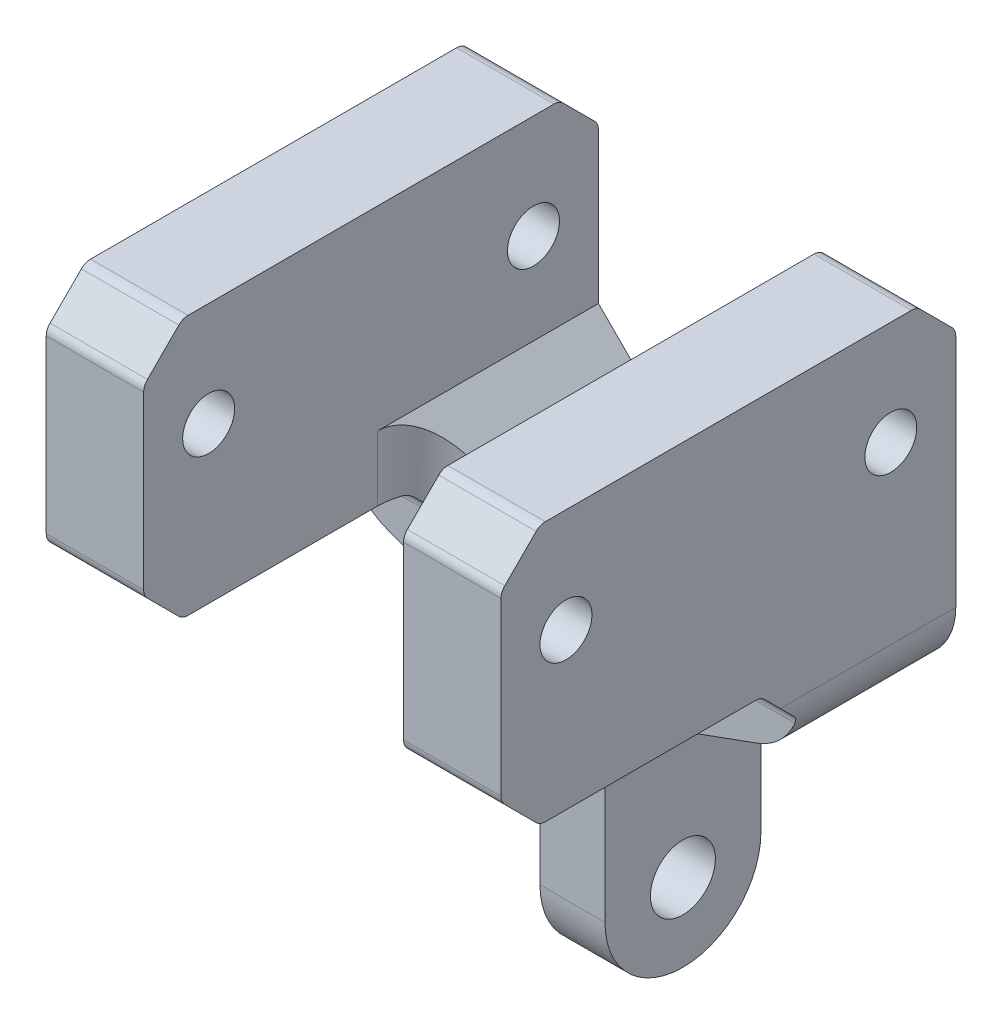
from build123d import *

# Parameters (mm, degrees)
BOSS_EXTRUDE1_DEPTH = 17.5
SKETCH2_W           = 20
SKETCH2_H           = 20
CUT_EXTRUDE1_DEPTH  = 64.492125496
SKETCH3_R           = 2
CUT_EXTRUDE2_DEPTH  = 71.356236397
CHAMFER1_SIZE       = 3
CHAMFER2_SIZE       = 5
FILLET1_RADIUS      = 6
FILLET1_LENGTH      = 5
SKETCH4_R           = 2.5
CUT_EXTRUDE3_DEPTH  = 35
FILLET2_R           = 5
FILLET3_R           = 1


with BuildPart() as part:
    # Sketch1 → Boss-Extrude1 (new, symmetric)
    with BuildSketch(Plane(origin=(0, 0, 0), x_dir=(0, 0, -1), z_dir=(1, 0, 0))):
        Polygon((0, 0), (-35, 0), (-35, -20), (-12, -20), (-12, -50), (0, -50), align=None)
    extrude(amount=BOSS_EXTRUDE1_DEPTH, both=True)

    # Sketch2 → Cut-Extrude1 (cut, through all)
    with BuildSketch(Plane(origin=(0, 0, 0), x_dir=(-1, 0, 0), z_dir=(0, 0, -1))):
        Polygon((17.5, -25), (2.5, -30.459553514), (2.5, -50), (17.5, -50), align=None)
        Polygon((-17.5, -50), (-17.5, -25), (-2.5, -30.459553514), (-2.5, -50), align=None)
        with Locations((0, -10)):
            Rectangle(SKETCH2_W, SKETCH2_H)
    extrude(amount=-CUT_EXTRUDE1_DEPTH, mode=Mode.SUBTRACT)

    # Sketch3 → Cut-Extrude2 (cut, through all)
    with BuildSketch(Plane.ZY.offset(17.5)):
        with Locations((5, -8)):
            Circle(SKETCH3_R)
        with Locations((30, -8)):
            Circle(SKETCH3_R)
    extrude(amount=-CUT_EXTRUDE2_DEPTH, mode=Mode.SUBTRACT)

    # Chamfer1
    chamfer1_edges = [part.edges().sort_by_distance(p)[0] for p in [
        (13.75, -20, 12),
        (13.75, -20, 35),
        (13.75, 0, 35),
        (13.75, 0, 0),
        (-13.75, -20, 12),
        (-13.75, -20, 35),
        (-13.75, 0, 35),
        (-13.75, 0, 0),
    ]]
    chamfer(chamfer1_edges, length=CHAMFER1_SIZE)

    # Chamfer2
    chamfer2_edges = [part.edges().sort_by_distance(p)[0] for p in [
        (-10, -20, 6),
        (10, -20, 6),
    ]]
    chamfer(chamfer2_edges, length=CHAMFER2_SIZE)

    # Fillet1: full round fillet: the end face becomes a half cylinder, R = half its width
    fillet1_face = Plane((0, -50, 6), x_dir=(1, 0, 0), z_dir=(0, -1, 0))  # on the end face: x along it, z out of the body
    fillet1_slab = fillet1_face.offset(-FILLET1_RADIUS / 2) * Box(FILLET1_LENGTH, 2 * FILLET1_RADIUS, FILLET1_RADIUS, mode=Mode.PRIVATE)  # the body's end, R deep
    fillet1_round = Plane((0, -44, 6), x_dir=(0, -1, 0), z_dir=(1, 0, 0)) * Cylinder(FILLET1_RADIUS, FILLET1_LENGTH, mode=Mode.PRIVATE)  # its axis R under the face
    add(fillet1_slab - fillet1_round, mode=Mode.SUBTRACT)

    # Sketch4 → Cut-Extrude3 (cut)
    with BuildSketch(Plane(origin=(2.5, 0, 0), x_dir=(0, 0, -1), z_dir=(1, 0, 0))):
        with Locations(Location((-6, -44, 0), (0, 0, 90))):
            Circle(SKETCH4_R)
    extrude(amount=-CUT_EXTRUDE3_DEPTH, mode=Mode.SUBTRACT)

    # Fillet2
    # the kernel refuses this fillet: 5 mm, written as the material it adds along each edge
    with BuildSketch(Plane(origin=(10, -35.5, 12), x_dir=(-1, 0, 0), z_dir=(0, 1, 0))) as fillet2_piece_1_section:
        with BuildLine():
            CenterArc((FILLET2_R, FILLET2_R), FILLET2_R, 180, 90)
            Line((0, FILLET2_R), (0, 0))
            Line((0, 0), (FILLET2_R, 0))
        make_face()
    fillet2_piece_1 = extrude(amount=33, mode=Mode.PRIVATE)
    fillet2_piece_1 = split(fillet2_piece_1, bisect_by=Plane(origin=(9.996559124, -19.16276417, 15.83723583), z_dir=(0, -0.7071067811865476, 0.7071067811865476)), keep=Keep.TOP, mode=Mode.PRIVATE)
    fillet2_piece_1 = split(fillet2_piece_1, bisect_by=Plane(origin=(9.996559124, -20, 16.11631444), z_dir=(0, 1, 0)), keep=Keep.TOP, mode=Mode.PRIVATE)
    add(fillet2_piece_1)
    with BuildSketch(Plane(origin=(10, -35.5, 12), x_dir=(-1, 0, 0), z_dir=(0, 1, 0))) as fillet2_piece_2_section:
        with BuildLine():
            CenterArc((FILLET2_R, FILLET2_R), FILLET2_R, 180, 90)
            Line((0, FILLET2_R), (0, 0))
            Line((0, 0), (FILLET2_R, 0))
        make_face()
    fillet2_piece_2 = extrude(amount=33, mode=Mode.PRIVATE)
    fillet2_piece_2 = split(fillet2_piece_2, bisect_by=Plane(origin=(8.541566655, -21.793394373, 13.206605627), z_dir=(0, 0.7071067811865476, -0.7071067811865476)), keep=Keep.TOP, mode=Mode.PRIVATE)
    fillet2_piece_2 = split(fillet2_piece_2, bisect_by=Plane(origin=(8.541566655, -20, 12.608807503), z_dir=(0, -1, 0)), keep=Keep.TOP, mode=Mode.PRIVATE)
    add(fillet2_piece_2)
    with BuildSketch(Plane(origin=(10, -35.5, 12), x_dir=(-1, 0, 0), z_dir=(0, 1, 0))) as fillet2_piece_3_section:
        with BuildLine():
            CenterArc((FILLET2_R, FILLET2_R), FILLET2_R, 180, 90)
            Line((0, FILLET2_R), (0, 0))
            Line((0, 0), (FILLET2_R, 0))
        make_face()
    fillet2_piece_3 = extrude(amount=33, mode=Mode.PRIVATE)
    fillet2_piece_3 = split(fillet2_piece_3, bisect_by=Plane(origin=(8.131124987, -16.868875013, 13.270711332), z_dir=(0.7071067811865476, -0.7071067811865476, 0)), keep=Keep.TOP, mode=Mode.PRIVATE)
    fillet2_piece_3 = split(fillet2_piece_3, bisect_by=Plane(origin=(9.156989341, -19.812014017, 15.187985983), z_dir=(0, 0.7071067811865476, -0.7071067811865476)), keep=Keep.TOP, mode=Mode.PRIVATE)
    fillet2_piece_3 = split(fillet2_piece_3, bisect_by=Plane(origin=(9.156989341, -20, 13.270711332), z_dir=(0, 1, 0)), keep=Keep.TOP, mode=Mode.PRIVATE)
    add(fillet2_piece_3)
    with BuildSketch(Plane(origin=(-10, -35.5, 12), x_dir=(0, 0, 1), z_dir=(0, 1, 0))) as fillet2_piece_4_section:
        with BuildLine():
            CenterArc((FILLET2_R, FILLET2_R), FILLET2_R, 180, 90)
            Line((0, FILLET2_R), (0, 0))
            Line((0, 0), (FILLET2_R, 0))
        make_face()
    fillet2_piece_4 = extrude(amount=33, mode=Mode.PRIVATE)
    fillet2_piece_4 = split(fillet2_piece_4, bisect_by=Plane(origin=(-8.541566654, -21.793394373, 13.206605627), z_dir=(0, 0.7071067811865476, -0.7071067811865476)), keep=Keep.TOP, mode=Mode.PRIVATE)
    fillet2_piece_4 = split(fillet2_piece_4, bisect_by=Plane(origin=(-8.541566654, -20, 12.608807503), z_dir=(0, -1, 0)), keep=Keep.TOP, mode=Mode.PRIVATE)
    add(fillet2_piece_4)
    with BuildSketch(Plane(origin=(-10, -35.5, 12), x_dir=(0, 0, 1), z_dir=(0, 1, 0))) as fillet2_piece_5_section:
        with BuildLine():
            CenterArc((FILLET2_R, FILLET2_R), FILLET2_R, 180, 90)
            Line((0, FILLET2_R), (0, 0))
            Line((0, 0), (FILLET2_R, 0))
        make_face()
    fillet2_piece_5 = extrude(amount=33, mode=Mode.PRIVATE)
    fillet2_piece_5 = split(fillet2_piece_5, bisect_by=Plane(origin=(-9.996559123, -19.16276417, 15.83723583), z_dir=(0, -0.7071067811865476, 0.7071067811865476)), keep=Keep.TOP, mode=Mode.PRIVATE)
    fillet2_piece_5 = split(fillet2_piece_5, bisect_by=Plane(origin=(-9.996559123, -20, 16.11631444), z_dir=(0, 1, 0)), keep=Keep.TOP, mode=Mode.PRIVATE)
    add(fillet2_piece_5)
    with BuildSketch(Plane(origin=(-10, -35.5, 12), x_dir=(0, 0, 1), z_dir=(0, 1, 0))) as fillet2_piece_6_section:
        with BuildLine():
            CenterArc((FILLET2_R, FILLET2_R), FILLET2_R, 180, 90)
            Line((0, FILLET2_R), (0, 0))
            Line((0, 0), (FILLET2_R, 0))
        make_face()
    fillet2_piece_6 = extrude(amount=33, mode=Mode.PRIVATE)
    fillet2_piece_6 = split(fillet2_piece_6, bisect_by=Plane(origin=(-9.156989342, -19.812014017, 15.187985983), z_dir=(0, 0.7071067811865476, -0.7071067811865476)), keep=Keep.TOP, mode=Mode.PRIVATE)
    fillet2_piece_6 = split(fillet2_piece_6, bisect_by=Plane(origin=(-8.131124988, -16.868875012, 13.270711332), z_dir=(-0.7071067811865476, -0.7071067811865476, 0)), keep=Keep.TOP, mode=Mode.PRIVATE)
    fillet2_piece_6 = split(fillet2_piece_6, bisect_by=Plane(origin=(-9.156989342, -20, 13.270711332), z_dir=(0, 1, 0)), keep=Keep.TOP, mode=Mode.PRIVATE)
    add(fillet2_piece_6)
    with BuildSketch(Plane(origin=(2.5, -30.459553514, 0), x_dir=(0, -1, 0), z_dir=(0, 0, 1)), Plane(origin=(-2.5, -30.459553514, 0), x_dir=(-0.9396926207859091, 0.34202014332566677, 0), z_dir=(0, 0, 1))) as fillet2_piece_7:
        with BuildLine():
            CenterArc((FILLET2_R * 0.70020753821, FILLET2_R), FILLET2_R, 200, 70)
            Line((-FILLET2_R * 0.239485082576, FILLET2_R * 0.657979856674), (0, 0))
            Line((0, 0), (FILLET2_R * 0.70020753821, 0))
        make_face()
    extrude(amount=12)
    # the kernel refuses this fillet: 5 mm, written as the material it takes off along each edge
    with BuildSketch(Plane(origin=(17.5, -25, -8.752594228), x_dir=(0, 1, 0), z_dir=(0, 0, 1))) as fillet2_2_piece_1:
        with BuildLine():
            CenterArc((FILLET2_R * 0.70020753821, FILLET2_R), FILLET2_R, 200, 70)
            Line((-FILLET2_R * 0.239485082576, FILLET2_R * 0.657979856674), (0, 0))
            Line((0, 0), (FILLET2_R * 0.70020753821, 0))
        make_face()
    extrude(amount=29.505188455, mode=Mode.SUBTRACT)
    with BuildSketch(Plane(origin=(-17.5, -25, -8.752594228), x_dir=(0, 1, 0), z_dir=(0, 0, 1))) as fillet2_2_piece_2:
        with BuildLine():
            CenterArc((FILLET2_R * 0.70020753821, -FILLET2_R), FILLET2_R, 90, 70)
            Line((-FILLET2_R * 0.239485082576, -FILLET2_R * 0.657979856674), (0, 0))
            Line((0, 0), (FILLET2_R * 0.70020753821, 0))
        make_face()
    extrude(amount=29.505188455, mode=Mode.SUBTRACT)

    # Fillet3
    fillet3_edges = [part.edges().sort_by_distance(p)[0] for p in [
        (11.134684772, -23, 12),
        (13.541287847, -20, 15),
        (13.75, -20, 32),
        (13.75, -17, 35),
        (13.75, 0, 32),
        (13.75, 0, 3),
        (13.75, -3, 0),
        (13.75, -3, 35),
        (-13.75, -20, 32),
        (-13.541287847, -20, 15),
        (-11.134684772, -23, 12),
        (-13.75, -3, 0),
        (-13.75, 0, 3),
        (-13.75, 0, 32),
        (-13.75, -3, 35),
        (-13.75, -17, 35),
    ]]
    fillet(fillet3_edges, radius=FILLET3_R)


solid = part.part
